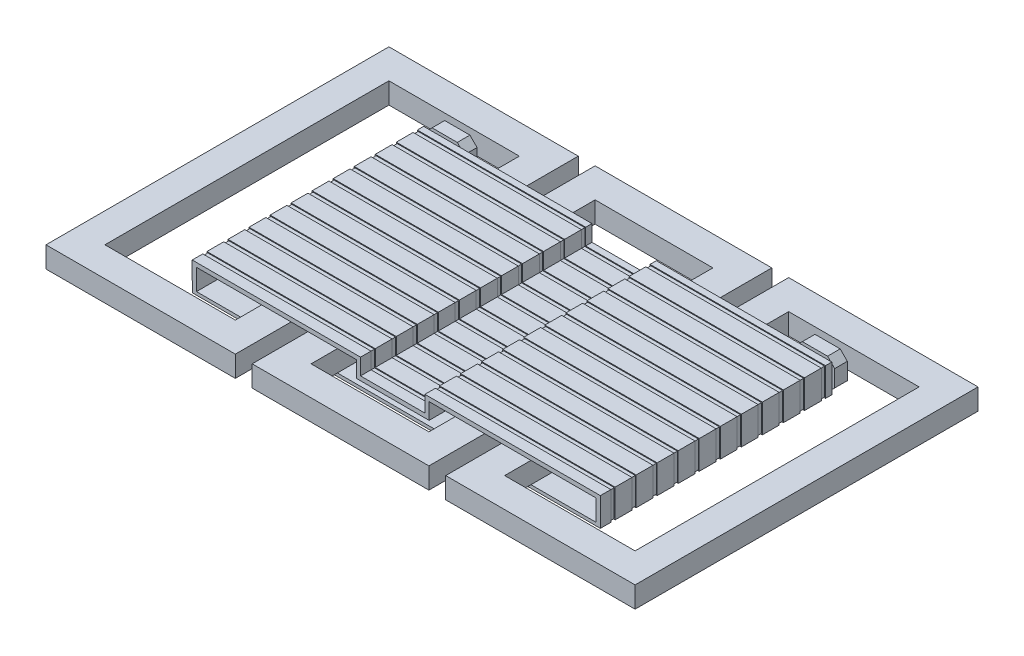
from build123d import *

# Parameters (mm, degrees)
SKETCH2_W               = 450
SKETCH2_H               = 815
SKETCH2_W_2             = 310
SKETCH2_H_2             = 675
EXTRUDE_THIN1_DEPTH     = 50
SKETCH2_W_3             = 420
SKETCH2_W_4             = 280
EXTRUDE_THIN1_2_DEPTH   = 50
EXTRUDE_THIN1_3_DEPTH   = 50
BOSS_EXTRUDE1_DEPTH     = 275
CUT_EXTRUDE_THIN1_DEPTH = 10
LPATTERN1_COUNT         = 6
LPATTERN1_PITCH         = 50
LPATTERN1_COL_COUNT     = 6
LPATTERN1_COL_PITCH     = 50
SKETCH6_W               = 70
SKETCH6_H               = 50
BOSS_EXTRUDE2_DEPTH     = 120
CHAMFER1_SIZE           = 10
EXTRUDE_THIN2_START     = -15
EXTRUDE_THIN2_DEPTH     = 30


# Read off the part's stored shape, not the designer's step: Extrude-Thin2
with BuildPart() as part:
    # Sketch2 → Extrude-Thin1 (new body)
    with BuildSketch(Plane(origin=(0, 0, 0), x_dir=(1, 0, 0), z_dir=(0, 1, 0))):
        with Locations((-475, 0)):
            Rectangle(SKETCH2_W, SKETCH2_H)
        with Locations((-475, 0)):
            Rectangle(SKETCH2_W_2, SKETCH2_H_2, mode=Mode.SUBTRACT)
    extrude(amount=EXTRUDE_THIN1_DEPTH)



with BuildPart() as body_2:
    # Sketch2 → Extrude-Thin1 2 (new body)
    with BuildSketch(Plane(origin=(0, 0, 0), x_dir=(1, 0, 0), z_dir=(0, 1, 0))):
        Rectangle(SKETCH2_W_3, SKETCH2_H)
        Rectangle(SKETCH2_W_4, SKETCH2_H_2, mode=Mode.SUBTRACT)
    extrude(amount=EXTRUDE_THIN1_2_DEPTH)


with BuildPart() as body_3:
    # Sketch2 → Extrude-Thin1 3 (new body)
    with BuildSketch(Plane(origin=(0, 0, 0), x_dir=(1, 0, 0), z_dir=(0, 1, 0))):
        with Locations((475, 0)):
            Rectangle(SKETCH2_W, SKETCH2_H)
        with Locations((475, 0)):
            Rectangle(SKETCH2_W_2, SKETCH2_H_2, mode=Mode.SUBTRACT)
    extrude(amount=EXTRUDE_THIN1_3_DEPTH)


with BuildPart() as part_1:
    add(part.part)

    add(body_2.part)  # Boss-Extrude1 merges body 2

    add(body_3.part)  # Boss-Extrude1 merges body 3
    # Sketch3 → Boss-Extrude1 (add, symmetric)
    with BuildSketch(Plane.XY):
        Polygon((-484.87694709, 0.284079302), (-485.024788019, 60), (-85, 60), (-85, 21.381266051), (67.961305095, 21.381266051), (67.961305095, 60), (485, 60), (485, 0), (485, -7.5), (-484.87694709, -7.5), align=None)
        Polygon((-474.876213138, 0), (-475, 50), (-95, 50), (-95, 11.381266051), (77.961305095, 11.381266051), (77.961305095, 50), (475, 50), (475, 0), align=None, mode=Mode.SUBTRACT)
    extrude(amount=BOSS_EXTRUDE1_DEPTH, both=True)

    # Sketch5 → Cut-Extrude-Thin1 (cut)
    with BuildSketch(Plane.XY):
        Polygon((-484.87694709, 0.284079302), (-484.87694709, -7.5), (485, -7.5), (485, 60), (67.961305095, 60), (67.961305095, 21.381266051), (-85, 21.381266051), (-85, 60), (-485.024788019, 60), align=None)
        Polygon((-482.87694709, 0.286555035), (-482.87694709, -5.5), (483, -5.5), (483, 58), (69.961305095, 58), (69.961305095, 19.381266051), (-87, 19.381266051), (-87, 58), (-483.019830415, 58), align=None, mode=Mode.SUBTRACT)
    cut_extrude_thin1 = extrude(amount=-CUT_EXTRUDE_THIN1_DEPTH, mode=Mode.SUBTRACT)

    # LPattern1: Cut-Extrude-Thin1 ×6
    with Locations(*[(0, 0, -i * LPATTERN1_PITCH) for i in range(1, LPATTERN1_COUNT)]):
        add(cut_extrude_thin1, mode=Mode.SUBTRACT)

    # LPattern1 col: Cut-Extrude-Thin1 ×6
    with Locations(*[(0, 0, i * LPATTERN1_COL_PITCH) for i in range(1, LPATTERN1_COL_COUNT)]):
        add(cut_extrude_thin1, mode=Mode.SUBTRACT)

    # Sketch6 → Boss-Extrude2 (add)
    with BuildSketch(Plane.XY.offset(-200)):
        with Locations((440, 25)):
            Rectangle(SKETCH6_W, SKETCH6_H)
        with Locations((-440, 25)):
            Rectangle(SKETCH6_W, SKETCH6_H)
    extrude(amount=-BOSS_EXTRUDE2_DEPTH)

    # Chamfer1
    chamfer1_edges = [part_1.edges().sort_by_distance(p)[0] for p in [
        (-440, 0, -320),
        (-405, 0, -297.5),
        (-475, 25, -320),
        (-475, 0, -297.5),
        (-440, 50, -320),
        (-475, 50, -297.5),
        (-405, 25, -320),
        (-405, 50, -297.5),
        (475, 25, -320),
        (475, 50, -297.5),
        (440, 0, -320),
        (475, 0, -297.5),
        (440, 50, -320),
        (405, 50, -297.5),
        (405, 25, -320),
        (405, 0, -297.5),
    ]]
    chamfer(chamfer1_edges, length=CHAMFER1_SIZE)

    # Extrude-Thin2 outline → Extrude-Thin2 (add)
    # profile 1 of 2: a face of its own
    with BuildSketch(Plane.XY.offset(-295).offset(EXTRUDE_THIN2_START)):
        Polygon((393, 44.970562748), (393, 5.029437252), (410.029437252, -12), (469.970562748, -12), (487, 5.029437252), (487, 44.970562748), (469.970562748, 62), (410.029437252, 62), align=None)
        Polygon((415, 50), (465, 50), (475, 40), (475, 10), (465, 0), (415, 0), (405, 10), (405, 40), align=None, mode=Mode.SUBTRACT)
    # profile 2 of 2: a face of its own
    with BuildSketch(Plane.XY.offset(-295).offset(EXTRUDE_THIN2_START)):
        Polygon((-487, 5.029437252), (-469.970562748, -12), (-410.029437252, -12), (-393, 5.029437252), (-393, 44.970562748), (-410.029437252, 62), (-469.970562748, 62), (-487, 44.970562748), align=None)
        Polygon((-465, 50), (-415, 50), (-405, 40), (-405, 10), (-415, 0), (-465, 0), (-475, 10), (-475, 40), align=None, mode=Mode.SUBTRACT)
    extrude(amount=EXTRUDE_THIN2_DEPTH)


solid = part_1.part
